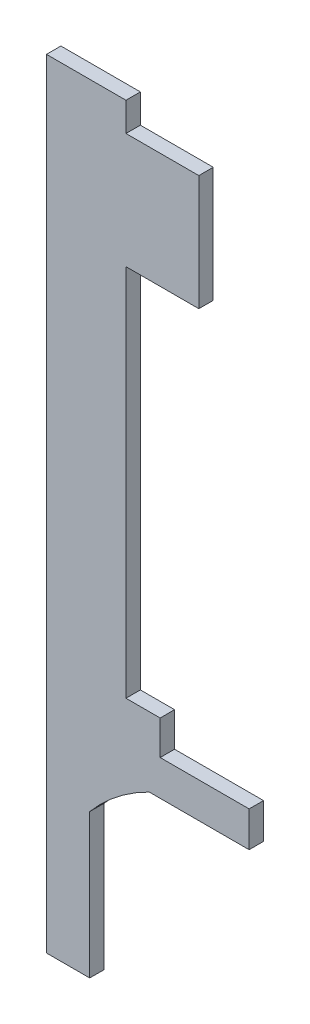
from build123d import *

# Parameters (mm, degrees)
BOSS_EXTRU_1_DEPTH = 5


with BuildPart() as part:
    # Esquisse1 → Boss.-Extru.1 (new body)
    with BuildSketch(Plane.XY):
        with BuildLine():
            Line((70.297192809, 66.186397284), (70.297192809, 78.451204868))
            Line((70.297192809, 78.451204868), (39.439293445, 78.451204868))
            Line((39.439293445, 78.451204868), (39.439293445, 90.333987182))
            Line((39.439293445, 90.333987182), (27.572537656, 90.333987182))
            Line((27.572537656, 90.333987182), (27.572537656, 220))
            Line((27.572537656, 220), (52.855036633, 220))
            Line((52.855036633, 220), (52.855036633, 260))
            Line((52.855036633, 260), (27.572537656, 260))
            Line((27.572537656, 260), (27.572537656, 270))
            Line((27.572537656, 270), (0, 270))
            Line((0, 270), (0, 0))
            Line((0, 0), (15, 0))
            Line((15, 0), (15, 50))
            ThreePointArc((15, 50), (24.488558001, 59.174106779), (35.670004688, 66.186397284))
            Line((35.670004688, 66.186397284), (70.297192809, 66.186397284))
        make_face()
    extrude(amount=BOSS_EXTRU_1_DEPTH)


solid = part.part
